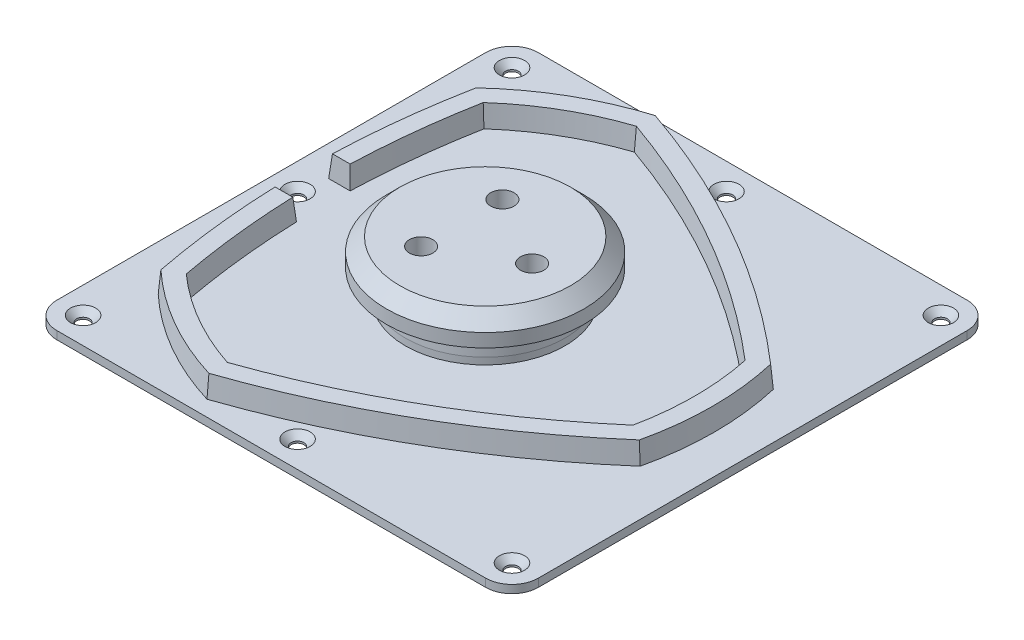
from build123d import *

# Parameters (mm, degrees)
SKETCH1_W                = 180
SKETCH1_H                = 180
SKETCH1_W_2              = 160
SKETCH1_H_2              = 160
SKETCH1_W_3              = 140
SKETCH1_H_3              = 140
BOSS_EXTRUDE1_DEPTH      = 3
SKETCH1_3_W              = 140
SKETCH1_3_H              = 140
BOSS_EXTRUDE2_DEPTH      = 5
SKETCH6_R                = 4.7
BOSS_EXTRUDE4_DEPTH      = 8
BOSS_EXTRUDE5_DEPTH      = 8
BOSS_EXTRUDE5_DRAFT      = 5
CUT_EXTRUDE1_START       = -5
SKETCH12_R               = 4.7
CUT_EXTRUDE1_DEPTH       = 5
SKETCH13_R               = 29.75
BOSS_EXTRUDE6_DEPTH      = 2.5
SKETCH14_R               = 29.75
SKETCH16_R               = 29.25
CUT_EXTRUDE2_START       = -2
CUT_EXTRUDE2_OUTLINE_R   = 34.25
CUT_EXTRUDE2_DEPTH       = 2
FILLET1_R                = 10
SKETCH19_W               = 140
SKETCH19_H               = 140
CUT_EXTRUDE3_DEPTH       = 5
F_5_16_CLEARANCE_HOLE1_D = 8.72998
SKETCH24_R               = 10
SKETCH24_R_2             = 4.36499
CUT_EXTRUDE4_DEPTH       = 7
CUT_EXTRUDE5_DEPTH       = 128.711589146
SKETCH26_R               = 29.35
SKETCH26_R_2             = 4.36499
BOSS_EXTRUDE7_DEPTH      = 4
SKETCH26_R_3             = 36.85
SKETCH26_R_4             = 32.85
BOSS_EXTRUDE7_2_DEPTH    = 4
SKETCH27_R               = 36.85
SKETCH27_R_2             = 32.85
SKETCH27_R_3             = 29.35
SKETCH27_R_4             = 4.36499
BOSS_EXTRUDE8_DEPTH      = 6
CHAMFER1_SIZE            = 5


# Read off the part's stored shape, not the designer's step: CSK for M4 Flat Head Machine Screw1, Cut-Extrude2
with BuildPart() as part:
    # Sketch1 → Boss-Extrude1 (new body)
    # profile 1 of 3: a face of its own
    with BuildSketch(Plane(origin=(0, 0, 0), x_dir=(1, 0, 0), z_dir=(0, 1, 0))):
        Rectangle(SKETCH1_W, SKETCH1_H)
        Rectangle(SKETCH1_W_2, SKETCH1_H_2, mode=Mode.SUBTRACT)
    # profile 2 of 3: a face of its own
    with BuildSketch(Plane(origin=(0, 0, 0), x_dir=(1, 0, 0), z_dir=(0, 1, 0))):
        Rectangle(SKETCH1_W_2, SKETCH1_H_2)
        Rectangle(SKETCH1_W_3, SKETCH1_H_3, mode=Mode.SUBTRACT)
    # profile 3 of 3: a face of its own
    with BuildSketch(Plane(origin=(0, 0, 0), x_dir=(1, 0, 0), z_dir=(0, 1, 0))):
        Rectangle(SKETCH1_W_3, SKETCH1_H_3)
    extrude(amount=BOSS_EXTRUDE1_DEPTH)

    # Sketch1<3> → Boss-Extrude2 (add)
    with BuildSketch(Plane(origin=(0, 0, 0), x_dir=(1, 0, 0), z_dir=(0, 1, 0))):
        Rectangle(SKETCH1_3_W, SKETCH1_3_H)
    extrude(amount=-BOSS_EXTRUDE2_DEPTH)

    # CSK for M4 Flat Head Machine Screw1 outl → CSK for M4 Flat Head Machine Screw1 (revolve, cut)
    with BuildSketch(Plane(origin=(-80, 0, 0), x_dir=(1, 0, 0), z_dir=(0, 0, 1))):
        Polygon((0, 0), (2.4, 0), (2.4, 0.7), (4.7, 3), (0, 3), align=None)
    revolve(axis=Axis((-80, 0, 0), (0, 1, 0)), mode=Mode.SUBTRACT)

    # CSK for M4 Flat Head Machine Screw1 2 ou → CSK for M4 Flat Head Machine Screw1 2 (revolve, cut)
    with BuildSketch(Plane.XY.offset(80)):
        Polygon((0, 0), (2.4, 0), (2.4, 0.7), (4.7, 3), (0, 3), align=None)
    revolve(axis=Axis((0, 0, 80), (0, 1, 0)), mode=Mode.SUBTRACT)

    # CSK for M4 Flat Head Machine Screw1 3 ou → CSK for M4 Flat Head Machine Screw1 3 (revolve, cut)
    with BuildSketch(Plane(origin=(80, 0, 0), x_dir=(1, 0, 0), z_dir=(0, 0, 1))):
        Polygon((0, 0), (2.4, 0), (2.4, 0.7), (4.7, 3), (0, 3), align=None)
    revolve(axis=Axis((80, 0, 0), (0, 1, 0)), mode=Mode.SUBTRACT)

    # CSK for M4 Flat Head Machine Screw1 4 ou → CSK for M4 Flat Head Machine Screw1 4 (revolve, cut)
    with BuildSketch(Plane.XY.offset(-80)):
        Polygon((0, 0), (2.4, 0), (2.4, 0.7), (4.7, 3), (0, 3), align=None)
    revolve(axis=Axis((0, 0, -80), (0, 1, 0)), mode=Mode.SUBTRACT)

    # CSK for M4 Flat Head Machine Screw1 5 ou → CSK for M4 Flat Head Machine Screw1 5 (revolve, cut)
    with BuildSketch(Plane(origin=(-80, 0, 80), x_dir=(1, 0, 0), z_dir=(0, 0, 1))):
        Polygon((0, 0), (2.4, 0), (2.4, 0.7), (4.7, 3), (0, 3), align=None)
    revolve(axis=Axis((-80, 0, 80), (0, 1, 0)), mode=Mode.SUBTRACT)

    # CSK for M4 Flat Head Machine Screw1 6 ou → CSK for M4 Flat Head Machine Screw1 6 (revolve, cut)
    with BuildSketch(Plane(origin=(80, 0, -80), x_dir=(1, 0, 0), z_dir=(0, 0, 1))):
        Polygon((0, 0), (2.4, 0), (2.4, 0.7), (4.7, 3), (0, 3), align=None)
    revolve(axis=Axis((80, 0, -80), (0, 1, 0)), mode=Mode.SUBTRACT)

    # CSK for M4 Flat Head Machine Screw1 7 ou → CSK for M4 Flat Head Machine Screw1 7 (revolve, cut)
    with BuildSketch(Plane(origin=(80, 0, 80), x_dir=(1, 0, 0), z_dir=(0, 0, 1))):
        Polygon((0, 0), (2.4, 0), (2.4, 0.7), (4.7, 3), (0, 3), align=None)
    revolve(axis=Axis((80, 0, 80), (0, 1, 0)), mode=Mode.SUBTRACT)

    # CSK for M4 Flat Head Machine Screw1 8 ou → CSK for M4 Flat Head Machine Screw1 8 (revolve, cut)
    with BuildSketch(Plane(origin=(-80, 0, -80), x_dir=(1, 0, 0), z_dir=(0, 0, 1))):
        Polygon((0, 0), (2.4, 0), (2.4, 0.7), (4.7, 3), (0, 3), align=None)
    revolve(axis=Axis((-80, 0, -80), (0, 1, 0)), mode=Mode.SUBTRACT)

    # CSK for M4 Flat Head Machine Screw1 9 ou → CSK for M4 Flat Head Machine Screw1 9 (revolve, cut)
    with BuildSketch(Plane.XY):
        Polygon((0, -5), (2.4, -5), (2.4, 0.7), (4.7, 3), (0, 3), align=None)
    revolve(axis=Axis((0, 0, 0), (0, 1, 0)), mode=Mode.SUBTRACT)

    # Sketch6 → Boss-Extrude4 (add, through all)
    with BuildSketch(Plane(origin=(0, 3, 0), x_dir=(1, 0, 0), z_dir=(0, 1, 0))):
        with Locations(Location((80, 0, 0), (0, 0, 270))):
            Circle(SKETCH6_R)
        Circle(SKETCH6_R)
    extrude(amount=-BOSS_EXTRUDE4_DEPTH)


with BuildPart() as boss_extrude5_tool:
    # Sketch10 → Boss-Extrude5 (with draft: the straight prism first)
    with BuildSketch(Plane(origin=(0, 3, 0), x_dir=(1, 0, 0), z_dir=(0, 1, 0))):
        with BuildLine():
            Line((-70.393178849, -10), (-78.397496431, -10))
            ThreePointArc((-78.397496431, -10), (-76.604236916, -34.68045004), (-72.838821124, -59.137801445))
            ThreePointArc((-72.838821124, -59.137801445), (-52.739092363, -74.026279442), (-29.795427813, -83.98891616))
            ThreePointArc((-29.795427813, -83.98891616), (24.279800219, -59.374355653), (72.634248938, -24.851114715))
            ThreePointArc((72.634248938, -24.851114715), (75.478184725, 0), (72.634248938, 24.851114715))
            ThreePointArc((72.634248938, 24.851114715), (24.279800219, 59.374355653), (-29.795427813, 83.98891616))
            ThreePointArc((-29.795427813, 83.98891616), (-52.739092363, 74.026279442), (-72.838821124, 59.137801445))
            ThreePointArc((-72.838821124, 59.137801445), (-76.604236916, 34.68045004), (-78.397496431, 10))
            Line((-78.397496431, 10), (-70.393178849, 10))
            ThreePointArc((-70.393178849, 10), (-68.785863401, 32.603044383), (-65.480018889, 55.020726474))
            ThreePointArc((-65.480018889, 55.020726474), (-48.739092363, 67.098076211), (-29.909337417, 75.557468997))
            ThreePointArc((-29.909337417, 75.557468997), (20.279800219, 52.446152423), (65.389356306, 20.536742523))
            ThreePointArc((65.389356306, 20.536742523), (67.478184725, 0), (65.389356306, -20.536742523))
            ThreePointArc((65.389356306, -20.536742523), (20.279800219, -52.446152423), (-29.909337417, -75.557468997))
            ThreePointArc((-29.909337417, -75.557468997), (-48.739092363, -67.098076211), (-65.480018889, -55.020726474))
            ThreePointArc((-65.480018889, -55.020726474), (-68.785863401, -32.603044383), (-70.393178849, -10))
        make_face()
    extrude(amount=BOSS_EXTRUDE5_DEPTH)
    # Boss-Extrude5: the draft: its side faces are tilted about the plane it starts from
    boss_extrude5_sides = [boss_extrude5_tool.faces().sort_by_distance(p)[0] for p in [
        (-74.39533764, 7, 10),
        (-76.604236916, 7, 34.68045004),
        (-52.739092363, 7, 74.026279442),
        (24.279800219, 7, 59.374355653),
        (75.478184725, 7, 0),
        (24.279800219, 7, -59.374355653),
        (-52.739092363, 7, -74.026279442),
        (-76.604236916, 7, -34.68045004),
        (-74.39533764, 7, -10),
        (-68.785863401, 7, -32.603044383),
        (-48.739092363, 7, -67.098076211),
        (20.279800219, 7, -52.446152423),
        (67.478184725, 7, 0),
        (20.279800219, 7, 52.446152423),
        (-48.739092363, 7, 67.098076211),
        (-68.785863401, 7, 32.603044383),
    ]]
    draft(boss_extrude5_sides, Plane(origin=(0, 3, 0), x_dir=(1, 0, 0), z_dir=(0, 1, 0)), BOSS_EXTRUDE5_DRAFT)


with BuildPart() as part_1:
    add(part.part)

    # Boss-Extrude5: add boss_extrude5_tool
    add(boss_extrude5_tool.part)

    # Sketch12 → Cut-Extrude1 (cut)
    with BuildSketch(Plane.XZ.offset(5).offset(CUT_EXTRUDE1_START)):
        with Locations((80, 0)):
            Circle(SKETCH12_R)
    extrude(amount=CUT_EXTRUDE1_DEPTH, mode=Mode.SUBTRACT)

    # Sketch13 → Boss-Extrude6 (add)
    with BuildSketch(Plane(origin=(0, 3, 0), x_dir=(1, 0, 0), z_dir=(0, 1, 0))):
        with Locations(Location((-10, 0, 0), (0, 0, 270))):
            Circle(SKETCH13_R)
    extrude(amount=BOSS_EXTRUDE6_DEPTH)

    # Sketch14 → Loft1 section 0
    with BuildSketch(Plane(origin=(0, 5.5, 0), x_dir=(1, 0, 0), z_dir=(0, 1, 0))):
        with Locations((-10, 0)):
            Circle(SKETCH14_R)
    # Sketch16 → Loft1 section 1
    with BuildSketch(Plane(origin=(0, 15.5, 0), x_dir=(1, 0, 0), z_dir=(0, 1, 0))):
        with Locations((-10, 0)):
            Circle(SKETCH16_R)
    loft()

    # Cut-Extrude2 outline → Cut-Extrude2 (cut)
    with BuildSketch(Plane(origin=(0, 15.5, 0), x_dir=(1, 0, 0), z_dir=(0, 1, 0)).offset(CUT_EXTRUDE2_START)):
        with Locations((-10, 0)):
            Circle(CUT_EXTRUDE2_OUTLINE_R)
    extrude(amount=CUT_EXTRUDE2_DEPTH, mode=Mode.SUBTRACT)

    # Fillet1
    fillet1_edges = [part_1.edges().sort_by_distance(p)[0] for p in [
        (-90, 1.5, 90),
        (-90, 1.5, -90),
        (90, 1.5, -90),
        (90, 1.5, 90),
    ]]
    fillet(fillet1_edges, radius=FILLET1_R)

    # Sketch19 → Cut-Extrude3 (cut)
    with BuildSketch(Plane.XZ.offset(5)):
        Rectangle(SKETCH19_W, SKETCH19_H)
    extrude(amount=-CUT_EXTRUDE3_DEPTH, mode=Mode.SUBTRACT)

    # 5/16 Clearance Hole1 (through all)
    with Locations(Plane(origin=(0, 13.5, 0), x_dir=(1, 0, 0), z_dir=(0, 1, 0))):
        with Locations((-18.75, 15.155444566), (7.5, 0), (-18.75, -15.155444566)):
            Hole(F_5_16_CLEARANCE_HOLE1_D / 2)

    # Sketch24 → Cut-Extrude4 (cut)
    # profile 1 of 6: a face of its own
    with BuildSketch(Plane.XZ):
        with Locations(Location((-18.75, 15.155444566, 0), (0, 0, 270))):
            Circle(SKETCH24_R)
        with Locations(Location((-18.75, 15.155444566, 0), (0, 0, 90))):
            Circle(SKETCH24_R_2, mode=Mode.SUBTRACT)
    # profile 2 of 6: a face of its own
    with BuildSketch(Plane.XZ):
        with Locations(Location((7.5, 0, 0), (0, 0, 270))):
            Circle(SKETCH24_R)
        with Locations(Location((7.5, 0, 0), (0, 0, 90))):
            Circle(SKETCH24_R_2, mode=Mode.SUBTRACT)
    # profile 3 of 6: a face of its own
    with BuildSketch(Plane.XZ):
        with Locations(Location((-18.75, -15.155444566, 0), (0, 0, 270))):
            Circle(SKETCH24_R)
        with Locations(Location((-18.75, -15.155444566, 0), (0, 0, 90))):
            Circle(SKETCH24_R_2, mode=Mode.SUBTRACT)
    # profile 4 of 6: a face of its own
    with BuildSketch(Plane.XZ):
        with Locations(Location((-18.75, -15.155444566, 0), (0, 0, 90))):
            Circle(SKETCH24_R_2)
    # profile 5 of 6: a face of its own
    with BuildSketch(Plane.XZ):
        with Locations(Location((-18.75, 15.155444566, 0), (0, 0, 90))):
            Circle(SKETCH24_R_2)
    # profile 6 of 6: a face of its own
    with BuildSketch(Plane.XZ):
        with Locations(Location((7.5, 0, 0), (0, 0, 90))):
            Circle(SKETCH24_R_2)
    extrude(amount=-CUT_EXTRUDE4_DEPTH, mode=Mode.SUBTRACT)

    # Sketch25 → Cut-Extrude5 (cut, through all)
    with BuildSketch(Plane(origin=(0, 3, 0), x_dir=(1, 0, 0), z_dir=(0, 1, 0))):
        with BuildLine():
            Line((90, -80), (90, 80))
            ThreePointArc((90, 80), (87.071067812, 87.071067812), (80, 90))
            Line((80, 90), (-80, 90))
            ThreePointArc((-80, 90), (-87.071067812, 87.071067812), (-90, 80))
            Line((-90, 80), (-90, -80))
            ThreePointArc((-90, -80), (-87.071067812, -87.071067812), (-80, -90))
            Line((-80, -90), (80, -90))
            ThreePointArc((80, -90), (87.071067812, -87.071067812), (90, -80))
        make_face()
        with BuildLine():
            Line((-80, 89.8), (80, 89.8))
            ThreePointArc((80, 89.8), (86.929646456, 86.929646456), (89.8, 80))
            Line((89.8, 80), (89.8, -80))
            ThreePointArc((89.8, -80), (86.929646456, -86.929646456), (80, -89.8))
            Line((80, -89.8), (-80, -89.8))
            ThreePointArc((-80, -89.8), (-86.929646456, -86.929646456), (-89.8, -80))
            Line((-89.8, -80), (-89.8, 80))
            ThreePointArc((-89.8, 80), (-86.929646456, 86.929646456), (-80, 89.8))
        make_face(mode=Mode.SUBTRACT)
    extrude(amount=-CUT_EXTRUDE5_DEPTH, mode=Mode.SUBTRACT)


with BuildPart() as body_2:
    # Sketch26 → Boss-Extrude7 (new body)
    with BuildSketch(Plane(origin=(0, 13.5, 0), x_dir=(1, 0, 0), z_dir=(0, 1, 0))):
        with Locations(Location((-10, 0, 0), (0, 0, 270))):
            Circle(SKETCH26_R)
        with Locations(Location((-18.75, -15.155444566, 0), (0, 0, 270))):
            Circle(SKETCH26_R_2, mode=Mode.SUBTRACT)
        with Locations(Location((7.5, 0, 0), (0, 0, 270))):
            Circle(SKETCH26_R_2, mode=Mode.SUBTRACT)
        with Locations(Location((-18.75, 15.155444566, 0), (0, 0, 270))):
            Circle(SKETCH26_R_2, mode=Mode.SUBTRACT)
    extrude(amount=BOSS_EXTRUDE7_DEPTH)



with BuildPart() as body_3:
    # Sketch26 → Boss-Extrude7 2 (new body)
    with BuildSketch(Plane(origin=(0, 13.5, 0), x_dir=(1, 0, 0), z_dir=(0, 1, 0))):
        with Locations(Location((-10, 0, 0), (0, 0, 270))):
            Circle(SKETCH26_R_3)
        with Locations(Location((-10, 0, 0), (0, 0, 270))):
            Circle(SKETCH26_R_4, mode=Mode.SUBTRACT)
    extrude(amount=BOSS_EXTRUDE7_2_DEPTH)


with BuildPart() as body_2_1:
    add(body_2.part)

    add(body_3.part)  # Boss-Extrude8 merges body 3
    # Sketch27 → Boss-Extrude8 (add)
    # profile 1 of 3: a face of its own
    with BuildSketch(Plane(origin=(0, 17.5, 0), x_dir=(1, 0, 0), z_dir=(0, 1, 0))):
        with Locations(Location((-10, 0, 0), (0, 0, 270))):
            Circle(SKETCH27_R)
        with Locations(Location((-10, 0, 0), (0, 0, 270))):
            Circle(SKETCH27_R_2, mode=Mode.SUBTRACT)
    # profile 2 of 3: a face of its own
    with BuildSketch(Plane(origin=(0, 17.5, 0), x_dir=(1, 0, 0), z_dir=(0, 1, 0))):
        with Locations(Location((-10, 0, 0), (0, 0, 270))):
            Circle(SKETCH27_R_2)
        with Locations(Location((-10, 0, 0), (0, 0, 270))):
            Circle(SKETCH27_R_3, mode=Mode.SUBTRACT)
    # profile 3 of 3: a face of its own
    with BuildSketch(Plane(origin=(0, 17.5, 0), x_dir=(1, 0, 0), z_dir=(0, 1, 0))):
        with Locations(Location((-10, 0, 0), (0, 0, 270))):
            Circle(SKETCH27_R_3)
        with Locations(Location((-18.75, 15.155444566, 0), (0, 0, 270))):
            Circle(SKETCH27_R_4, mode=Mode.SUBTRACT)
        with Locations(Location((-18.75, -15.155444566, 0), (0, 0, 270))):
            Circle(SKETCH27_R_4, mode=Mode.SUBTRACT)
        with Locations(Location((7.5, 0, 0), (0, 0, 270))):
            Circle(SKETCH27_R_4, mode=Mode.SUBTRACT)
    extrude(amount=BOSS_EXTRUDE8_DEPTH)

    # Chamfer1
    chamfer1_edges = [body_2_1.edges().sort_by_distance(p)[0] for p in [
        (-10, 23.5, -36.85),
    ]]
    chamfer(chamfer1_edges, length=CHAMFER1_SIZE)


solid = Compound([part_1.part, body_2_1.part])
